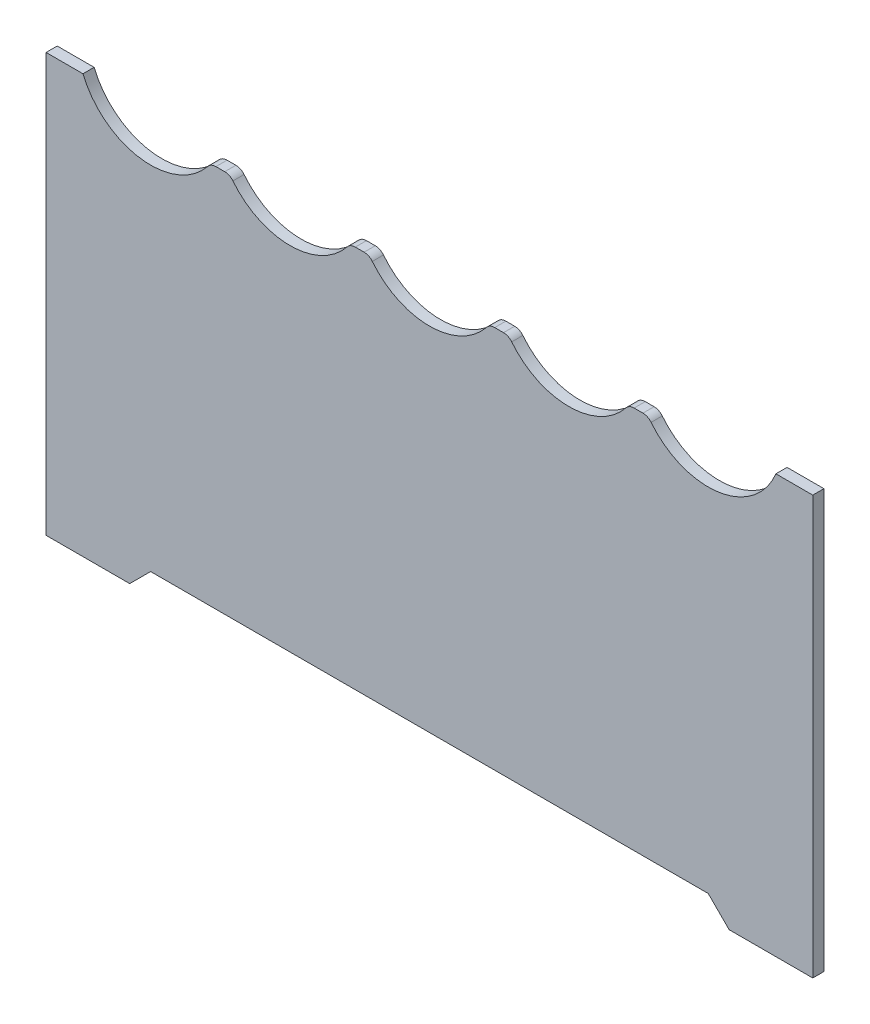
from build123d import *

# Parameters (mm, degrees)
BOSS_EXTRUDE1_DEPTH = 1.6


with BuildPart() as part:
    # Sketch2 → Boss-Extrude1 (new body)
    with BuildSketch(Plane.XY):
        with BuildLine():
            Line((-43, 0), (-40, 3))
            Line((-40, 3), (40, 3))
            Line((40, 3), (43, 0))
            Line((43, 0), (55, 0))
            Line((55, 0), (55, 60))
            Line((55, 60), (49.708243919, 60))
            ThreePointArc((49.708243919, 60), (41.487581503, 53.605910272), (31.803440127, 57.4375))
            ThreePointArc((31.803440127, 57.4375), (31.282022055, 57.852081728), (30.632503002, 58))
            Line((30.632503002, 58), (29.367496998, 58))
            ThreePointArc((29.367496998, 58), (28.717977945, 57.852081728), (28.196559873, 57.4375))
            ThreePointArc((28.196559873, 57.4375), (20, 53.5), (11.803440127, 57.4375))
            ThreePointArc((11.803440127, 57.4375), (11.282022055, 57.852081728), (10.632503002, 58))
            Line((10.632503002, 58), (9.367496998, 58))
            ThreePointArc((9.367496998, 58), (8.717977945, 57.852081728), (8.196559873, 57.4375))
            ThreePointArc((8.196559873, 57.4375), (0, 53.5), (-8.196559873, 57.4375))
            ThreePointArc((-8.196559873, 57.4375), (-8.717977945, 57.852081728), (-9.367496998, 58))
            Line((-9.367496998, 58), (-10.632503002, 58))
            ThreePointArc((-10.632503002, 58), (-11.282022055, 57.852081728), (-11.803440127, 57.4375))
            ThreePointArc((-11.803440127, 57.4375), (-20, 53.5), (-28.196559873, 57.4375))
            ThreePointArc((-28.196559873, 57.4375), (-28.717977945, 57.852081728), (-29.367496998, 58))
            Line((-29.367496998, 58), (-30.632503002, 58))
            ThreePointArc((-30.632503002, 58), (-31.282022055, 57.852081728), (-31.803440127, 57.4375))
            ThreePointArc((-31.803440127, 57.4375), (-41.487581503, 53.605910272), (-49.708243919, 60))
            Line((-49.708243919, 60), (-55, 60))
            Line((-55, 60), (-55, 0))
            Line((-55, 0), (-43, 0))
        make_face()
    extrude(amount=BOSS_EXTRUDE1_DEPTH)


solid = part.part
